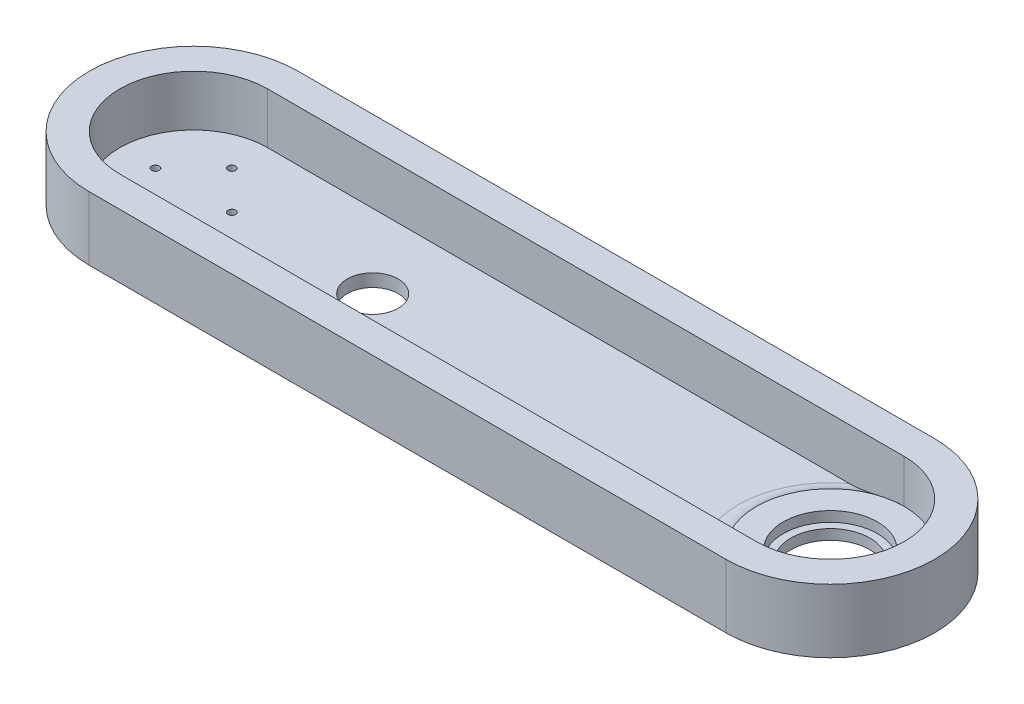
from build123d import *

# Parameters (mm, degrees)
BOSS_EXTRUDE1_DEPTH     = 20
BOSS_EXTRUDE2_START     = -5
BOSS_EXTRUDE2_DEPTH     = 5
CUT_EXTRUDE1_DEPTH      = 295.553899991
CUT_EXTRUDE1_DEPTH_BACK = 295.553899991
SKETCH3_R               = 1.5
SKETCH4_R               = 29
BOSS_EXTRUDE3_DEPTH     = 3
SKETCH5_R               = 18.5
CUT_EXTRUDE2_DEPTH      = 4
CUT_EXTRUDE3_DEPTH      = 295.623488541
CUT_EXTRUDE3_DEPTH_BACK = 295.623488541
SKETCH6_R               = 15.5
FILLET1_R               = 10
CUT_EXTRUDE4_DEPTH      = 295.553899998
CUT_EXTRUDE4_DEPTH_BACK = 295.553899998
SKETCH7_R               = 10


with BuildPart() as part:
    # Sketch1 → Boss-Extrude1 (new body)
    with BuildSketch(Plane(origin=(0, 0, 0), x_dir=(1, 0, 0), z_dir=(0, 1, 0))):
        with BuildLine():
            Line((0, -41), (250, -41))
            ThreePointArc((250, -41), (291, 0), (250, 41))
            Line((250, 41), (0, 41))
            ThreePointArc((0, 41), (-41, 0), (0, -41))
        make_face()
        with BuildLine():
            Line((0, 29), (250, 29))
            ThreePointArc((250, 29), (279, 0), (250, -29))
            Line((250, -29), (0, -29))
            ThreePointArc((0, -29), (-29, 0), (0, 29))
        make_face(mode=Mode.SUBTRACT)
    extrude(amount=BOSS_EXTRUDE1_DEPTH)

    # Sketch1<2> → Boss-Extrude2 (add)
    with BuildSketch(Plane(origin=(0, 0, 0), x_dir=(1, 0, 0), z_dir=(0, 1, 0)).offset(BOSS_EXTRUDE2_START)):
        with BuildLine():
            ThreePointArc((0, 41), (-41, 0), (0, -41))
            Line((0, -41), (250, -41))
            ThreePointArc((250, -41), (291, 0), (250, 41))
            Line((250, 41), (0, 41))
        make_face()
    extrude(amount=BOSS_EXTRUDE2_DEPTH)

    # Sketch3 → Cut-Extrude1 (cut, two sides: drawn at the far end of the back side and taken through both)
    with BuildSketch(Plane(origin=(0, 0, 0), x_dir=(1, 0, 0), z_dir=(0, 1, 0)).offset(-CUT_EXTRUDE1_DEPTH_BACK)):
        with Locations(Location((0, 15, 0), (0, 0, 270))):
            Circle(SKETCH3_R)
        with Locations(Location((15, 0, 0), (0, 0, 270))):
            Circle(SKETCH3_R)
        with Locations(Location((0, -15, 0), (0, 0, 270))):
            Circle(SKETCH3_R)
        with Locations(Location((-15, 0, 0), (0, 0, 270))):
            Circle(SKETCH3_R)
    extrude(amount=CUT_EXTRUDE1_DEPTH + CUT_EXTRUDE1_DEPTH_BACK, mode=Mode.SUBTRACT)

    # Sketch4 → Boss-Extrude3 (add)
    with BuildSketch(Plane(origin=(0, 0, 0), x_dir=(1, 0, 0), z_dir=(0, 1, 0))):
        with Locations((250, 0)):
            Circle(SKETCH4_R)
    extrude(amount=BOSS_EXTRUDE3_DEPTH)

    # Sketch5 → Cut-Extrude2 (cut)
    with BuildSketch(Plane(origin=(0, 3, 0), x_dir=(1, 0, 0), z_dir=(0, 1, 0))):
        with Locations(Location((250, 0, 0), (0, 0, 270))):
            Circle(SKETCH5_R)
    extrude(amount=-CUT_EXTRUDE2_DEPTH, mode=Mode.SUBTRACT)

    # Sketch6 → Cut-Extrude3 (cut, two sides: drawn at the far end of the back side and taken through both)
    with BuildSketch(Plane(origin=(0, -1, 0), x_dir=(1, 0, 0), z_dir=(0, 1, 0)).offset(-CUT_EXTRUDE3_DEPTH_BACK)):
        with Locations(Location((250, 0, 0), (0, 0, 270))):
            Circle(SKETCH6_R)
    extrude(amount=CUT_EXTRUDE3_DEPTH + CUT_EXTRUDE3_DEPTH_BACK, mode=Mode.SUBTRACT)

    # Fillet1
    # the kernel refuses this fillet: 10 mm, written as the material it adds along each edge
    with BuildSketch(Plane(origin=(250, 0, 0), x_dir=(0.5782894613752282, 0, -0.8158316608604672), z_dir=(0.8158316608604672, 0, 0.5782894613752282))) as fillet1_piece_1:
        with BuildLine():
            CenterArc((36.141428429, 10), FILLET1_R, 224.427004001, 45.572995999)
            Line((36.141428429, 0), (36.141428429, -0.2))
            Line((36.141428429, -0.2), (29, -0.2))
            Line((29, -0.2), (28.8, 0))
            ThreePointArc((28.8, 0), (28.8, 1.5), (28.857171431, 2.86))
            Line((28.857171431, 2.86), (29, 3))
        make_face()
    revolve(axis=Axis((250, 0, 0), (0, 1, 0)), revolution_arc=250.660644369)

    # Sketch7 → Cut-Extrude4 (cut, two sides: drawn at the far end of the back side and taken through both)
    with BuildSketch(Plane(origin=(0, 0, 0), x_dir=(1, 0, 0), z_dir=(0, 1, 0)).offset(-CUT_EXTRUDE4_DEPTH_BACK)):
        with Locations(Location((70.3, 0, 0), (0, 0, 270))):
            Circle(SKETCH7_R)
    extrude(amount=CUT_EXTRUDE4_DEPTH + CUT_EXTRUDE4_DEPTH_BACK, mode=Mode.SUBTRACT)


solid = part.part
